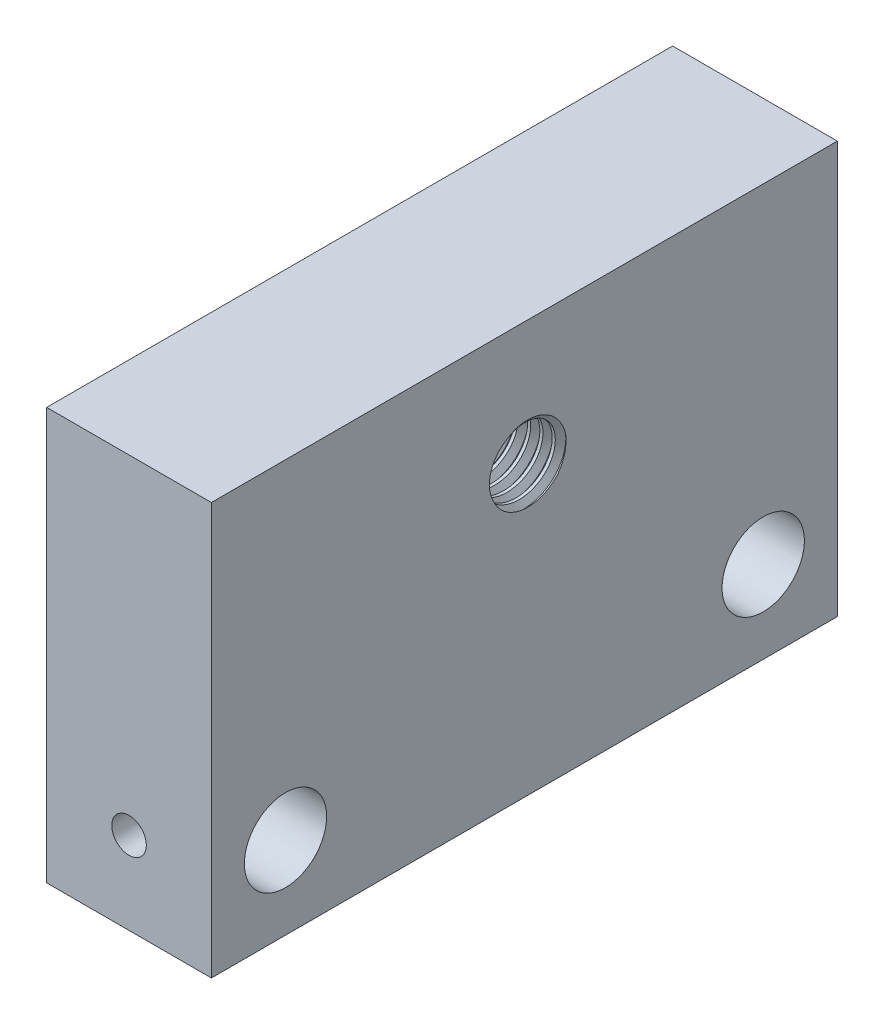
from build123d import *

# Parameters (mm, degrees)
BOSS_EXTRUDE1_DEPTH   = 50
M10_TAPPED_HOLE1_D    = 8.5
THREAD1_PITCH         = 1.5000000000000002
SKETCH2_R             = 5.0000000000000036
SKETCH2_R_2           = 4.9999999999999964
CUT_EXTRUDE2_DEPTH    = 66.90902855906769
M5_TAPPED_HOLE2_D     = 4.2
M5_TAPPED_HOLE2_DEPTH = 10
M5_TAPPED_HOLE2_TIP   = 1.2618072999578767
M5_TAPPED_HOLE4_D     = 4.2
M5_TAPPED_HOLE4_DEPTH = 10
M5_TAPPED_HOLE4_TIP   = 1.2618072999578767


with BuildPart() as part:
    # Sketch1 → Boss-Extrude1 (new body)
    with BuildSketch(Plane(origin=(0, 0, 0), x_dir=(1, 0, 0), z_dir=(0, 1, 0))):
        Polygon((9.999999999999996, 37.99999999999999), (-10.000000000000004, 37.99999999999999), (-9.999999999999995, -38), (10.000000000000005, -38.00000000000001), align=None)
    extrude(amount=BOSS_EXTRUDE1_DEPTH)

    # M10 Tapped Hole1 (through all)
    with Locations(Plane(origin=(10.000000000000002, 0, -1.14e-15), x_dir=(-1.2e-16, 0, -1), z_dir=(1, 0, -1.2e-16))):
        with Locations((0, 35)):
            Hole(M10_TAPPED_HOLE1_D / 2)

    # Thread1: the profile of Thread Profile1 profile screwed along a right-hand helix of 13.333333 turns, 8 arcs to a turn; built about Z, then put on its axis
    thread1_z = Axis((0, 0, 0), (0, 0, 1))
    thread1_corners = [(4.2497, 0, -0.000173205), (5.061898812, 0, 0.468749998), (5.061898812, 0, 0.656249998), (4.2497, 0, 1.125173201)]
    with BuildLine(mode=Mode.PRIVATE) as thread1_profile:
        Line(thread1_corners[0], thread1_corners[1])
        Line(thread1_corners[1], thread1_corners[2])
        Line(thread1_corners[2], thread1_corners[3])
        Line(thread1_corners[3], thread1_corners[0])
    thread1_cap = Face(thread1_profile.wire())
    thread1_turn_angles = [0, 22.5, 45, 67.5, 90, 112.5, 135, 157.5, 180, 202.5, 225, 247.5, 270, 292.5, 315, 337.5, 360]
    thread1_turn_weights = [1, 0.9238795325112867, 1, 0.9238795325112867, 1, 0.9238795325112867, 1, 0.9238795325112867, 1, 0.9238795325112867, 1, 0.9238795325112867, 1, 0.9238795325112867, 1, 0.9238795325112867, 1]
    thread1_turn_rails = [Edge.make_bspline([Vector(p[0], p[1], 0).rotate(thread1_z, thread1_turn_angles[k]) / thread1_turn_weights[k] + Vector(0, 0, p[2] + THREAD1_PITCH * thread1_turn_angles[k] / 360) for k in range(17)], [0, 0, 0, 1, 1, 2, 2, 3, 3, 4, 4, 5, 5, 6, 6, 7, 7, 8, 8, 8], 2, thread1_turn_weights) for p in thread1_corners]
    thread1_turn_sides = [Face.make_surface_from_curves(thread1_turn_rails[p[0]], thread1_turn_rails[p[1]]) for p in [(0, 1), (1, 2), (2, 3), (3, 0)]]
    thread1_last_angles = [4680, 4702.5, 4725, 4747.5, 4770, 4785, 4800]
    thread1_last_weights = [1, 0.9238795325112867, 1, 0.9238795325112867, 1, 0.9659258262890703, 1]
    thread1_last_rails = [Edge.make_bspline([Vector(p[0], p[1], 0).rotate(thread1_z, thread1_last_angles[k]) / thread1_last_weights[k] + Vector(0, 0, p[2] + THREAD1_PITCH * thread1_last_angles[k] / 360) for k in range(7)], [0, 0, 0, 1, 1, 2, 2, 3, 3, 3], 2, thread1_last_weights) for p in thread1_corners]
    thread1_last_sides = [Face.make_surface_from_curves(thread1_last_rails[p[0]], thread1_last_rails[p[1]]) for p in [(0, 1), (1, 2), (2, 3), (3, 0)]]
    thread1 = Plane(origin=(-10, 35, 0), x_dir=(0, 0, -1), z_dir=(1, 0, 0)) * Solid(Shell([*[p.moved(Location((0, 0, THREAD1_PITCH * i))) for i in range(13) for p in thread1_turn_sides], *thread1_last_sides, thread1_cap, thread1_cap.rotate(thread1_z, 4800).moved(Location((0, 0, THREAD1_PITCH * 4800 / 360)))]))
    add(thread1, mode=Mode.SUBTRACT)

    # Sketch2 → Cut-Extrude2 (cut, through all)
    with BuildSketch(Plane(origin=(10.000000000000002, 0, -1.14e-15), x_dir=(-1.2e-16, 0, -1), z_dir=(1, 0, -1.2e-16))):
        with Locations((-28.999999999999996, 10.000000000000002)):
            Circle(SKETCH2_R)
        with Locations(Location((29.000000000000004, 10.000000000000009, 0), (0, 0, 180))):
            Circle(SKETCH2_R_2)
    extrude(amount=-CUT_EXTRUDE2_DEPTH, mode=Mode.SUBTRACT)

    # M5 Tapped Hole2
    with Locations(Plane(origin=(0, 0, -37.99999999999999), x_dir=(-1, 0, 1.7e-16), z_dir=(-1.7e-16, 0, -1))):
        with Locations((0, 10)):
            Hole(M5_TAPPED_HOLE2_D / 2, depth=M5_TAPPED_HOLE2_DEPTH)
            with Locations((0, 0, -(M5_TAPPED_HOLE2_DEPTH + M5_TAPPED_HOLE2_TIP / 2))):  # 118° drill point
                Cone(0, M5_TAPPED_HOLE2_D / 2, M5_TAPPED_HOLE2_TIP, mode=Mode.SUBTRACT)

    # M5 Tapped Hole4
    with Locations(Plane.XY.offset(38)):
        with Locations((0, 10)):
            Hole(M5_TAPPED_HOLE4_D / 2, depth=M5_TAPPED_HOLE4_DEPTH)
            with Locations((0, 0, -(M5_TAPPED_HOLE4_DEPTH + M5_TAPPED_HOLE4_TIP / 2))):  # 118° drill point
                Cone(0, M5_TAPPED_HOLE4_D / 2, M5_TAPPED_HOLE4_TIP, mode=Mode.SUBTRACT)


solid = part.part
